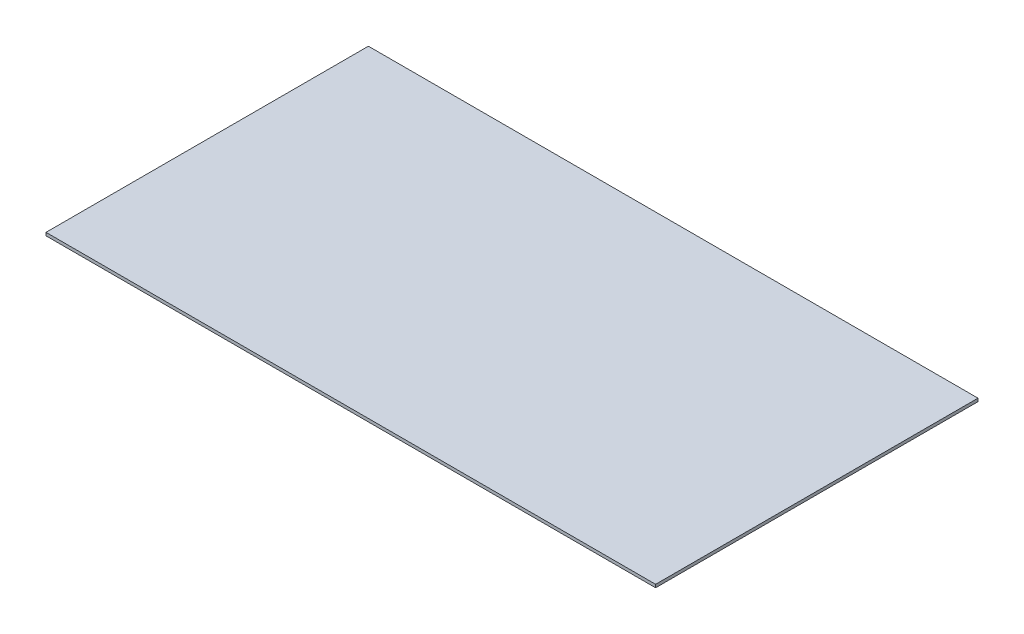
from build123d import *

# Parameters (mm, degrees)
SKETCH1_W           = 457.2
SKETCH1_H           = 2.286
BOSS_EXTRUDE1_DEPTH = 238.620000026
SKETCH2_W           = 457.2
SKETCH2_H           = 2.286
BOSS_EXTRUDE2_DEPTH = 3.175


with BuildPart() as part:
    # Sketch1 → Boss-Extrude1 (new body)
    with BuildSketch(Plane.XY):
        Rectangle(SKETCH1_W, SKETCH1_H)
    extrude(amount=BOSS_EXTRUDE1_DEPTH)

    # Sketch2 → Boss-Extrude2 (add)
    with BuildSketch(Plane(origin=(0, 0, 0), x_dir=(-1, 0, 0), z_dir=(0, 0, -1))):
        Rectangle(SKETCH2_W, SKETCH2_H)
    extrude(amount=BOSS_EXTRUDE2_DEPTH)


solid = part.part
